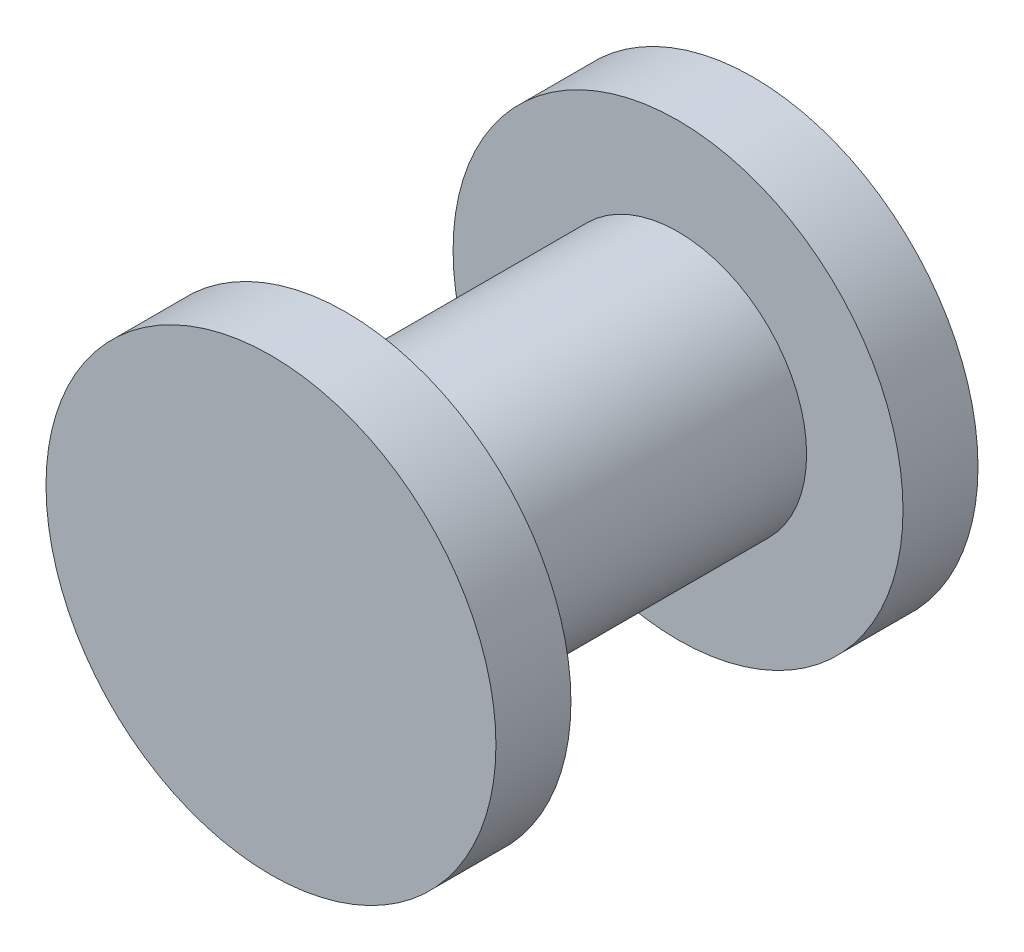
from build123d import *

# Parameters (mm, degrees)
SKETCH1_R           = 21
BOSS_EXTRUDE1_DEPTH = 7
SKETCH4_R           = 12
BOSS_EXTRUDE2_DEPTH = 31
BOSS_EXTRUDE3_START = 7
SKETCH5_R           = 21
BOSS_EXTRUDE3_DEPTH = 7


with BuildPart() as part:
    # Sketch1 → Boss-Extrude1 (new body)
    with BuildSketch(Plane.XY):
        Circle(SKETCH1_R)
    extrude(amount=BOSS_EXTRUDE1_DEPTH)

    # Sketch4 → Boss-Extrude2 (add)
    with BuildSketch(Plane(origin=(0, 0, 0), x_dir=(-1, 0, 0), z_dir=(0, 0, -1))):
        Circle(SKETCH4_R)
    extrude(amount=BOSS_EXTRUDE2_DEPTH)

    # Sketch5 → Boss-Extrude3 (add)
    with BuildSketch(Plane(origin=(0, 0, -31), x_dir=(-1, 0, 0), z_dir=(0, 0, -1)).offset(BOSS_EXTRUDE3_START)):
        Circle(SKETCH5_R)
    extrude(amount=-BOSS_EXTRUDE3_DEPTH)


solid = part.part
